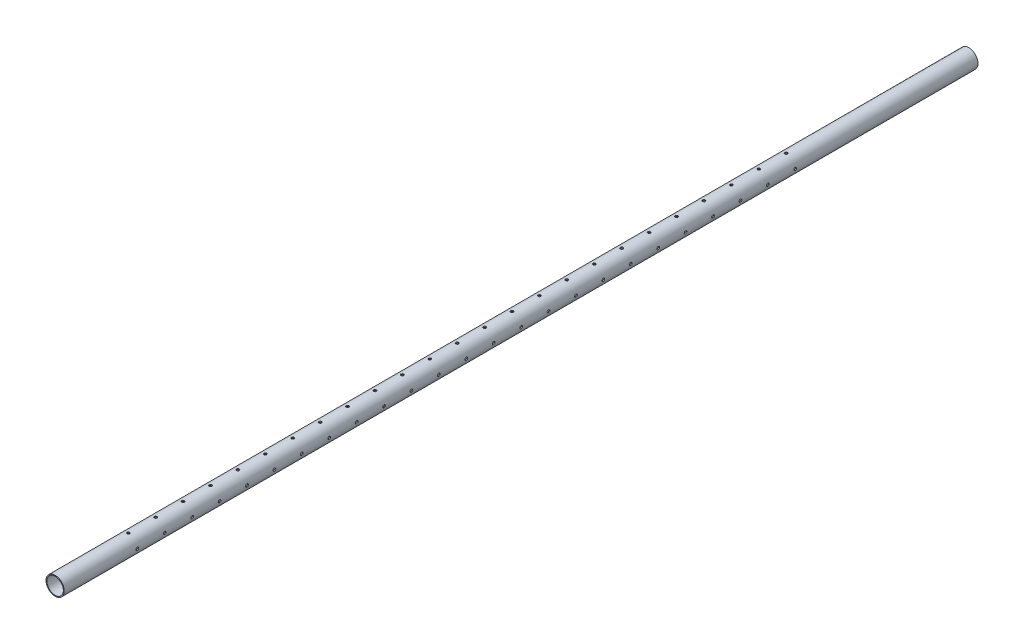
from build123d import *

# Parameters (mm, degrees)
SKETCH1_R             = 10
SKETCH1_R_2           = 9
BOSS_EXTRUDE1_DEPTH   = 1000
F_3_0MM_DOWEL_HOLE1_D = 3
F_3_0MM_DOWEL_HOLE2_D = 3


with BuildPart() as part:
    # Sketch1 → Boss-Extrude1 (new body)
    with BuildSketch(Plane.XY):
        Circle(SKETCH1_R)
        Circle(SKETCH1_R_2, mode=Mode.SUBTRACT)
    extrude(amount=BOSS_EXTRUDE1_DEPTH)

    # Ø3.0mm Dowel Hole1 (through all)
    with Locations(Plane(origin=(0, 10, 0), x_dir=(1, 0, 0), z_dir=(0, 1, 0))):
        with Locations((0, -200), (0, -230), (0, -260), (0, -290), (0, -320), (0, -350), (0, -380), (0, -410), (0, -440), (0, -470), (0, -500), (0, -530), (0, -560), (0, -590), (0, -620), (0, -650), (0, -680), (0, -710), (0, -740), (0, -770), (0, -800), (0, -830), (0, -860), (0, -890), (0, -920)):
            Hole(F_3_0MM_DOWEL_HOLE1_D / 2)

    # Ø3.0mm Dowel Hole2 (through all)
    with Locations(Plane(origin=(10, 0, 0), x_dir=(0, 0, -1), z_dir=(1, 0, 0))):
        with Locations((-200, 0), (-230, 0), (-260, 0), (-290, 0), (-320, 0), (-350, 0), (-380, 0), (-410, 0), (-440, 0), (-470, 0), (-500, 0), (-530, 0), (-560, 0), (-590, 0), (-620, 0), (-650, 0), (-680, 0), (-710, 0), (-740, 0), (-770, 0), (-800, 0), (-830, 0), (-860, 0), (-890, 0), (-920, 0)):
            Hole(F_3_0MM_DOWEL_HOLE2_D / 2)


solid = part.part
